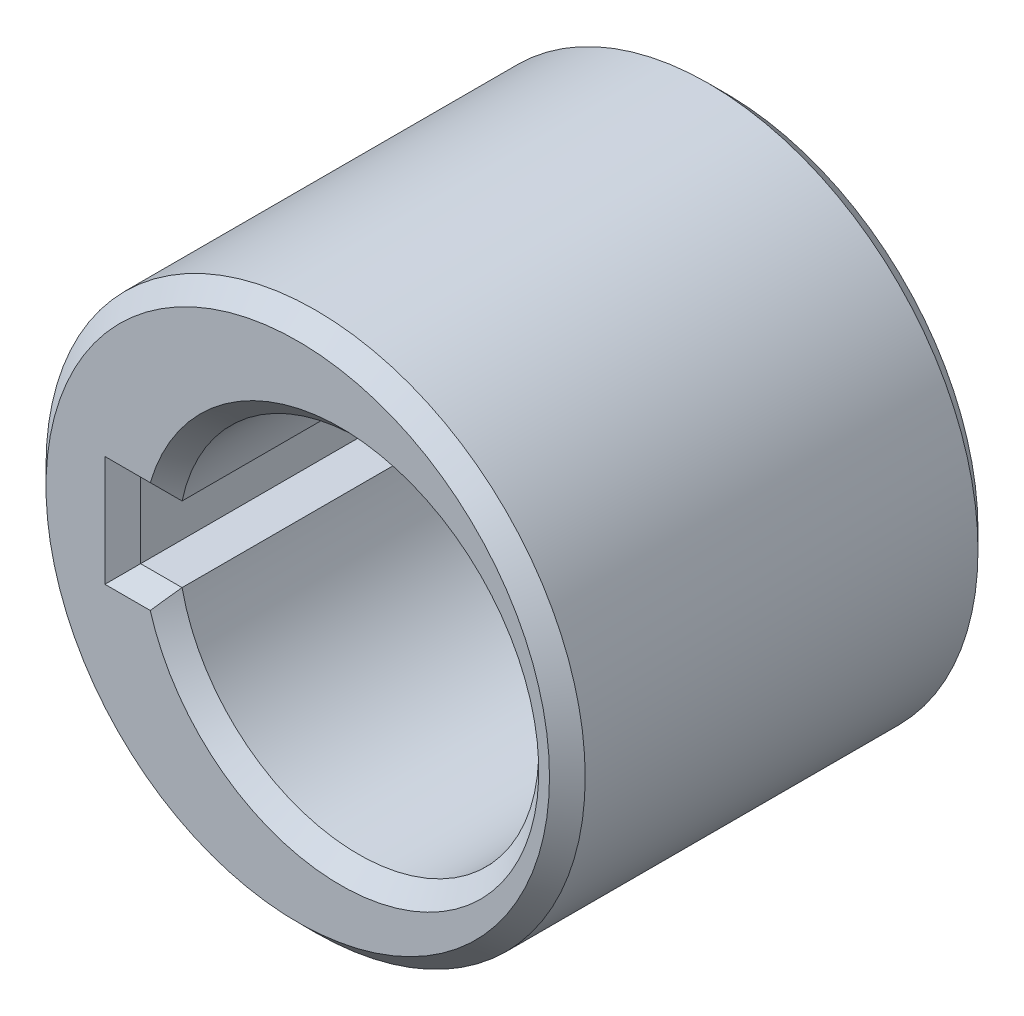
from build123d import *

# Parameters (mm, degrees)
SKETCH1_R           = 7.55
SKETCH1_R_2         = 5.05
BOSS_EXTRUDE1_DEPTH = 12
SKETCH2_W           = 6.1
SKETCH2_H           = 2.1
CUT_EXTRUDE1_DEPTH  = 17.66028211
CHAMFER1_SIZE       = 0.5
CHAMFER2_SIZE       = 0.5
CHAMFER3_SIZE       = 0.5


with BuildPart() as part:
    # Sketch1 → Boss-Extrude1 (new body)
    with BuildSketch(Plane.XY):
        with Locations((-1.2, 0)):
            Circle(SKETCH1_R)
        Circle(SKETCH1_R_2, mode=Mode.SUBTRACT)
    extrude(amount=BOSS_EXTRUDE1_DEPTH)

    # Sketch2 → Cut-Extrude1 (cut, through all)
    with BuildSketch(Plane.XY.offset(12)):
        with Locations((-3.05, 0)):
            Rectangle(SKETCH2_W, SKETCH2_H)
    extrude(amount=-CUT_EXTRUDE1_DEPTH, mode=Mode.SUBTRACT)

    # Chamfer1
    chamfer1_edges = [part.edges().sort_by_distance(p)[0] for p in [
        (-6.1, 0, 12),
        (-5.519817807, 1.05, 12),
        (-5.519817807, -1.05, 12),
        (5.05, 0, 12),
    ]]
    chamfer(chamfer1_edges, length=CHAMFER1_SIZE)

    # Chamfer2
    chamfer2_edges = [part.edges().sort_by_distance(p)[0] for p in [
        (5.05, 0, 0),
        (-5.519817807, -1.05, 0),
        (-5.519817807, 1.05, 0),
        (-6.1, 0, 0),
    ]]
    chamfer(chamfer2_edges, length=CHAMFER2_SIZE)

    # Chamfer3
    chamfer3_edges = [part.edges().sort_by_distance(p)[0] for p in [
        (-8.75, 0, 0),
        (-8.75, 0, 12),
    ]]
    chamfer(chamfer3_edges, length=CHAMFER3_SIZE)


solid = part.part
